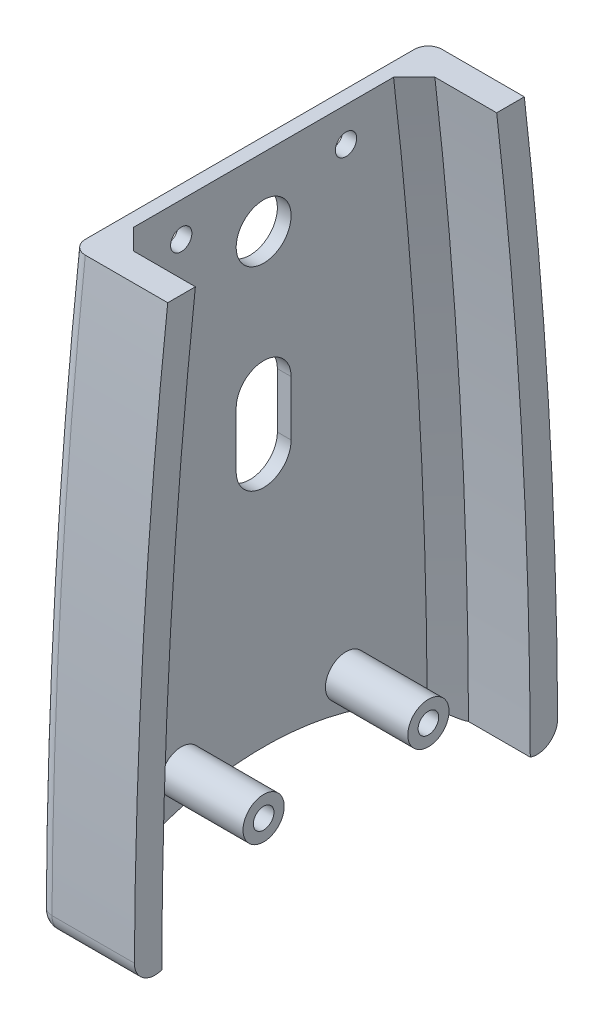
from build123d import *

# Parameters (mm, degrees)
SKETCH1_R           = 1.5499999999999983
BOSS_EXTRUDE1_DEPTH = 2
CUT_EXTRUDE1_DEPTH  = 2
BOSS_EXTRUDE2_DEPTH = 12
SKETCH4_R           = 1.5000000000000009
CUT_EXTRUDE2_DEPTH  = 2
SKETCH_8_R          = 3
EXTRUDE_1_DEPTH     = 12
CHAMFER6_SIZE       = 3
SKETCH_1_R          = 4.0000000000000036
CUT_EXTRUDE_1_DEPTH = 10
SKETCH_9_R          = 1.5000000000000009
CUT_EXTRUDE_2_DEPTH = 125.68382559540109
FILLET_1_R          = 2
SKETCH_10_W         = 2
SKETCH_10_H         = 7.38673868931825
CUT_EXTRUDE_3_DEPTH = 1


with BuildPart() as part:
    # Sketch1 → Boss-Extrude1 (new body)
    with BuildSketch(Plane(origin=(0, 0, 0), x_dir=(0, 0, -1), z_dir=(1, 0, 0))):
        with BuildLine():
            Line((-25.968110327255765, 120.00000000000003), (25.968110327255765, 120.00000000000003))
            ThreePointArc((25.968110327255765, 120.00000000000003), (29.488419187011914, 79.62790655837495), (30.82293132778887, 39.124603227985936))
            ThreePointArc((30.82293132778887, 39.124603227985936), (29.206107258133628, 36.44471853371224), (26.083845229838534, 36.66239231138328))
            ThreePointArc((26.083845229838534, 36.66239231138328), (-6.3665e-13, 44.994421787238764), (-26.083845229839092, 36.66239231138189))
            ThreePointArc((-26.083845229839092, 36.66239231138189), (-29.20610725813421, 36.44471853371079), (-30.82293132778949, 39.1246032279845))
            ThreePointArc((-30.82293132778949, 39.1246032279845), (-29.488419187012596, 79.6279065583745), (-25.968110327255765, 120.00000000000003))
        make_face()
        with Locations((-11.999999999999995, 115)):
            Circle(SKETCH1_R, mode=Mode.SUBTRACT)
        with Locations((12.000000000000005, 115)):
            Circle(SKETCH1_R, mode=Mode.SUBTRACT)
    extrude(amount=BOSS_EXTRUDE1_DEPTH)

    # Sketch2 → Cut-Extrude1 (cut)
    with BuildSketch(Plane(origin=(2, 0, 0), x_dir=(0, 0, -1), z_dir=(1, 0, 0))):
        with BuildLine():
            Line((4, 89.70000000000002), (4.000000000000003, 81.7))
            ThreePointArc((4.000000000000003, 81.7), (1.16e-15, 77.7), (-4.000000000000001, 81.7))
            Line((-4.000000000000001, 81.7), (-4.0000000000000036, 89.70000000000002))
            ThreePointArc((-4.0000000000000036, 89.70000000000002), (-3.1e-16, 93.70000000000002), (4, 89.70000000000002))
        make_face()
    extrude(amount=-CUT_EXTRUDE1_DEPTH, mode=Mode.SUBTRACT)

    # Sketch3 → Boss-Extrude2 (add)
    with BuildSketch(Plane(origin=(2, 0, 0), x_dir=(0, 0, -1), z_dir=(1, 0, 0))):
        with BuildLine():
            Line((-21.94183683045926, 120.00000000000003), (-25.968110327255765, 120.00000000000003))
            ThreePointArc((-25.968110327255772, 120.00000000000003), (-29.488419187012482, 79.6279065583743), (-30.82293132778932, 39.124603227984586))
            ThreePointArc((-30.822931327789238, 39.1246032279846), (-29.56718535087633, 36.66600228940771), (-26.834368801169504, 36.274428235935545))
            ThreePointArc((-26.83436880116949, 36.27442823593551), (-25.56563052181184, 78.20602334586083), (-21.941836830459124, 120.00000000000003))
        make_face()
        with BuildLine():
            Line((25.968110327255545, 119.99999999999999), (21.941836830459355, 119.99999999999999))
            ThreePointArc((21.94183683045935, 120.00000000000006), (25.565630521812068, 78.20602334586118), (26.834368801169717, 36.27442823593619))
            ThreePointArc((26.834368801169717, 36.27442823593619), (29.567185350876464, 36.66600228940895), (30.822931327789195, 39.124603227985936))
            ThreePointArc((30.822931327789092, 39.124603227985936), (29.48841918701214, 79.62790655837497), (25.96811032725543, 119.99999999999999))
        make_face()
    extrude(amount=BOSS_EXTRUDE2_DEPTH)

    # Sketch4 → Cut-Extrude2 (cut)
    with BuildSketch(Plane.ZY):
        with Locations((-12, 48)):
            Circle(SKETCH4_R)
        with Locations((12, 48)):
            Circle(SKETCH4_R)
    extrude(amount=-CUT_EXTRUDE2_DEPTH, mode=Mode.SUBTRACT)

    # 草图8 → 凸台-拉伸1 (add)
    with BuildSketch(Plane(origin=(2, 0, 0), x_dir=(0, 0, -1), z_dir=(1, 0, 0))):
        with Locations(Location((-12, 48, 0), (0, 0, 180))):
            Circle(SKETCH_8_R)
        with Locations(Location((12, 48, 0), (0, 0, 180))):
            Circle(SKETCH_8_R)
    extrude(amount=EXTRUDE_1_DEPTH)

    # Chamfer6
    chamfer6_edges = [part.edges().sort_by_distance(p)[0] for p in [
        (2, 78.20602334586118, -25.565630521811954),
        (2, 78.20602334586081, 25.565630521811727),
    ]]
    chamfer(chamfer6_edges, length=CHAMFER6_SIZE)

    # 草图1 → 切除-拉伸1 (cut)
    with BuildSketch(Plane.ZY):
        with Locations((0, 110.00000000000003)):
            Circle(SKETCH_1_R)
    extrude(amount=-CUT_EXTRUDE_1_DEPTH, mode=Mode.SUBTRACT)

    # 草图9 → 切除-拉伸2 (cut, through all)
    with BuildSketch(Plane.ZY):
        with Locations((-12, 48)):
            Circle(SKETCH_9_R)
        with Locations((12, 48)):
            Circle(SKETCH_9_R)
    extrude(amount=-CUT_EXTRUDE_2_DEPTH, mode=Mode.SUBTRACT)

    # 圆角1
    fillet_1_edges = [part.edges().sort_by_distance(p)[0] for p in [
        (0, 44.994421787238764, 4.9916e-13),
        (0, 36.44471853371079, 29.20610725813421),
        (0, 79.62790655837429, 29.488419187012596),
        (0, 79.62790655837495, -29.4884191870118),
        (0, 36.44471853371224, -29.206107258133624),
    ]]
    fillet(fillet_1_edges, radius=FILLET_1_R - 0.0001)  # a hair under: the kernel refuses the full size

    # 草图10 → 切除-拉伸3 (cut)
    with BuildSketch(Plane.ZY):
        with Locations((0, 47.46265164885683)):
            Rectangle(SKETCH_10_W, SKETCH_10_H)
    extrude(amount=-CUT_EXTRUDE_3_DEPTH, mode=Mode.SUBTRACT)


solid = part.part
